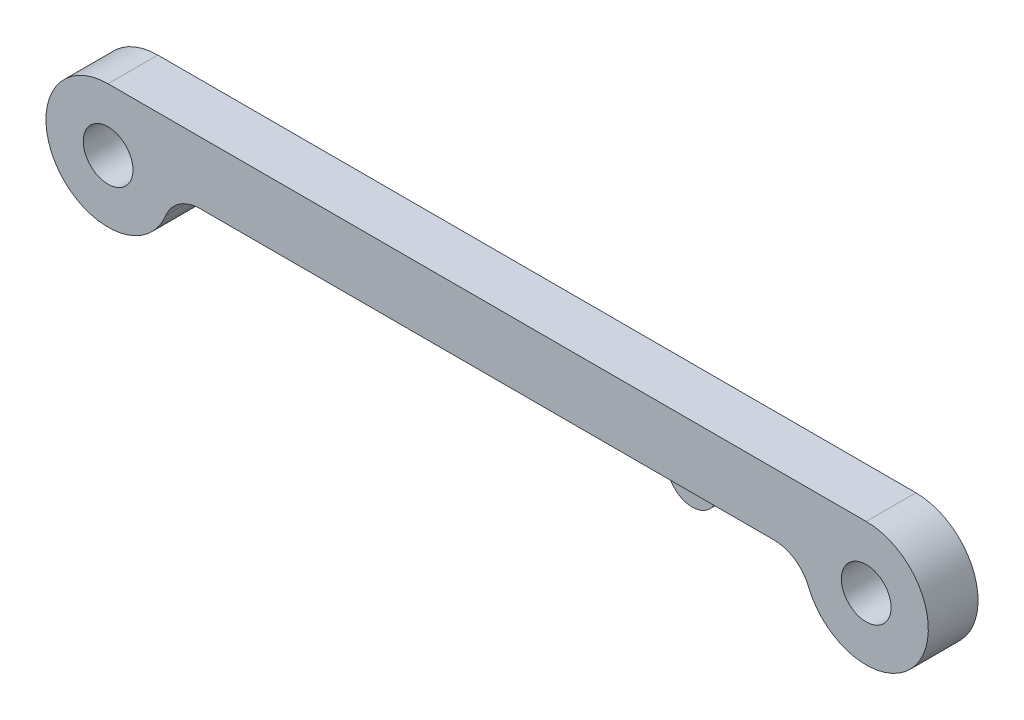
from build123d import *

# Parameters (mm, degrees)
SKETCH1_R           = 2
BOSS_EXTRUDE1_DEPTH = 4
BOSS_EXTRUDE3_START = -1
SKETCH3_R           = 2
SKETCH3_R_2         = 1
BOSS_EXTRUDE3_DEPTH = 2
FILLET1_R           = 1


with BuildPart() as part:
    # Sketch1 → Boss-Extrude1 (new body)
    with BuildSketch(Plane.XY):
        with BuildLine():
            Line((-63.221147144, 4.5), (-2.221147144, 4.5))
            ThreePointArc((-2.221147144, 4.5), (1.924633844, -3.295084972), (-6.856271198, -2.375))
            ThreePointArc((-6.856271198, -2.375), (-7.960294648, -1.012531407), (-9.637345631, -0.5))
            Line((-9.637345631, -0.5), (-55.804948657, -0.5))
            ThreePointArc((-55.804948657, -0.5), (-57.48199964, -1.012531407), (-58.586023089, -2.375))
            ThreePointArc((-58.586023089, -2.375), (-67.366928132, -3.295084972), (-63.221147144, 4.5))
        make_face()
        with Locations((-63.221147144, -0.5)):
            Circle(SKETCH1_R, mode=Mode.SUBTRACT)
        with Locations((-2.221147144, -0.5)):
            Circle(SKETCH1_R, mode=Mode.SUBTRACT)
    extrude(amount=BOSS_EXTRUDE1_DEPTH)

    # Sketch3 → Boss-Extrude3 (add)
    with BuildSketch(Plane.XY.offset(4).offset(BOSS_EXTRUDE3_START)):
        with Locations((-17.221147144, -0.5)):
            Circle(SKETCH3_R)
        with Locations((-17.221147144, -0.5)):
            Circle(SKETCH3_R_2, mode=Mode.SUBTRACT)
    extrude(amount=-BOSS_EXTRUDE3_DEPTH)

    # Fillet1
    fillet1_edges = [part.edges().sort_by_distance(p)[0] for p in [
        (-19.221147144, -0.5, 2),
        (-15.221147144, -0.5, 2),
    ]]
    fillet(fillet1_edges, radius=FILLET1_R)


solid = part.part
